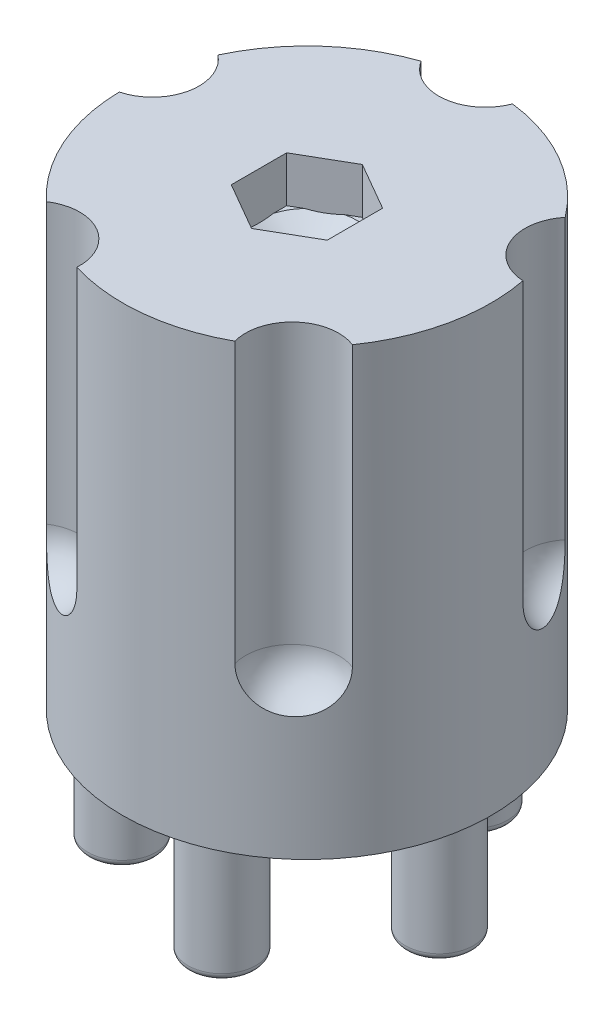
from build123d import *

# Parameters (mm, degrees)
SKETCH1_R           = 25.75
BOSS_EXTRUDE1_DEPTH = 62
SKETCH2_R           = 4.75
BOSS_EXTRUDE2_DEPTH = 18
FILLET1_R           = 1
FILLET2_R           = 1
CUT_EXTRUDE1_DEPTH  = 6.4
SKETCH4_R           = 10
CUT_EXTRUDE2_DEPTH  = 45
SKETCH5_R           = 4
CUT_EXTRUDE3_DEPTH  = 73.767609553
SKETCH6_R           = 6.5
CUT_EXTRUDE4_DEPTH  = 45
FILLET3_R           = 6
CHAMFER3_SIZE       = 3
CHAMFER3_SIZE_2     = 1.732050808
SKETCH7_R           = 6.6
CUT_EXTRUDE5_DEPTH  = 6


with BuildPart() as part:
    # Sketch1 → Boss-Extrude1 (new body)
    with BuildSketch(Plane(origin=(0, 0, 0), x_dir=(1, 0, 0), z_dir=(0, 1, 0))):
        with Locations(Location((0, 0, 0), (0, 0, 270))):
            Circle(SKETCH1_R)
    extrude(amount=BOSS_EXTRUDE1_DEPTH)

    # Sketch2 → Boss-Extrude2 (add)
    with BuildSketch(Plane.XZ):
        with Locations(Location((18.5, 0, 0), (0, 0, 90))):
            Circle(SKETCH2_R)
        with Locations(Location((5.716814396, -17.594545551, 0), (0, 0, 90))):
            Circle(SKETCH2_R)
        with Locations(Location((-14.966814396, -10.874027167, 0), (0, 0, 90))):
            Circle(SKETCH2_R)
        with Locations(Location((-14.966814396, 10.874027167, 0), (0, 0, 90))):
            Circle(SKETCH2_R)
        with Locations(Location((5.716814396, 17.594545551, 0), (0, 0, 90))):
            Circle(SKETCH2_R)
    extrude(amount=BOSS_EXTRUDE2_DEPTH)

    # Fillet1
    fillet1_edges = [part.edges().sort_by_distance(p)[0] for p in [
        (-14.966814396, 0, -15.624027167),
        (-14.966814396, 0, 6.124027167),
        (5.716814396, 0, 12.844545551),
        (18.5, 0, -4.75),
        (5.716814396, 0, -22.344545551),
    ]]
    fillet(fillet1_edges, radius=FILLET1_R)

    # Fillet2
    fillet2_edges = [part.edges().sort_by_distance(p)[0] for p in [
        (-14.966814396, -18, -15.624027167),
        (-14.966814396, -18, 6.124027167),
        (5.716814396, -18, 12.844545551),
        (18.5, -18, -4.75),
        (5.716814396, -18, -22.344545551),
    ]]
    fillet(fillet2_edges, radius=FILLET2_R)

    # Sketch3 → Cut-Extrude1 (cut)
    with BuildSketch(Plane(origin=(0, 62, 0), x_dir=(1, 0, 0), z_dir=(0, 1, 0))):
        Polygon((0, -7.736493607), (6.7, -3.868246804), (6.7, 3.868246804), (0, 7.736493607), (-6.7, 3.868246804), (-6.7, -3.868246804), align=None)
    extrude(amount=-CUT_EXTRUDE1_DEPTH, mode=Mode.SUBTRACT)

    # Sketch4 → Cut-Extrude2 (cut)
    with BuildSketch(Plane.XZ):
        with Locations(Location((0, 0, 0), (0, 0, 270))):
            Circle(SKETCH4_R)
    extrude(amount=-CUT_EXTRUDE2_DEPTH, mode=Mode.SUBTRACT)

    # Sketch5 → Cut-Extrude3 (cut, through all)
    with BuildSketch(Plane.XZ.offset(-45)):
        with Locations(Location((0, 0, 0), (0, 0, 270))):
            Circle(SKETCH5_R)
    extrude(amount=-CUT_EXTRUDE3_DEPTH, mode=Mode.SUBTRACT)

    # Sketch6 → Cut-Extrude4 (cut)
    with BuildSketch(Plane(origin=(0, 62, 0), x_dir=(1, 0, 0), z_dir=(0, 1, 0))):
        with Locations((-14, -24.248711306)):
            Circle(SKETCH6_R)
        with Locations((-27.388132821, 5.821527343)):
            Circle(SKETCH6_R)
        with Locations((-2.926796971, 27.84661307)):
            Circle(SKETCH6_R)
        with Locations((25.579272814, 11.388626006)):
            Circle(SKETCH6_R)
        with Locations((18.735656978, -20.808055113)):
            Circle(SKETCH6_R)
    extrude(amount=-CUT_EXTRUDE4_DEPTH, mode=Mode.SUBTRACT)

    # Fillet3
    # the kernel refuses this fillet: 6 mm, written as the material it adds along each edge
    with BuildSketch(Plane(origin=(-14, 17, 24.248711306), x_dir=(-0.5027182271719127, 0, 0.8644503363809452), z_dir=(0.8644503363809452, 0, 0.5027182271719127))) as fillet3_piece_1_section:
        with BuildLine():
            CenterArc((6.5 - FILLET3_R, -FILLET3_R), FILLET3_R, 0, 90)
            Line((6.5 - FILLET3_R, 0), (6.5, 0))
            Line((6.5, 0), (6.5, -FILLET3_R))
        make_face()
    fillet3_piece_1 = revolve(axis=Axis((-14, 17, 24.248711306), (0, -1, 0)), revolution_arc=359.64, mode=Mode.PRIVATE)
    fillet3_piece_1 = fillet3_piece_1 & Plane(origin=(0, 19.401898433, 0), x_dir=(0, 0, 1), z_dir=(0, -1, 0)) * Cylinder(25.75, 27, mode=Mode.PRIVATE)
    add(fillet3_piece_1)
    with BuildSketch(Plane(origin=(-27.388132821, 17, -5.821527343), x_dir=(-0.9774896010068019, 0, -0.21098360107734276), z_dir=(-0.21098360107734276, 0, 0.9774896010068019))) as fillet3_piece_2_section:
        with BuildLine():
            CenterArc((6.5 - FILLET3_R, -FILLET3_R), FILLET3_R, 0, 90)
            Line((6.5 - FILLET3_R, 0), (6.5, 0))
            Line((6.5, 0), (6.5, -FILLET3_R))
        make_face()
    fillet3_piece_2 = revolve(axis=Axis((-27.388132821, 17, -5.821527343), (0, -1, 0)), revolution_arc=359.64, mode=Mode.PRIVATE)
    fillet3_piece_2 = fillet3_piece_2 & Plane(origin=(0, 19.401898433, 0), x_dir=(0, 0, 1), z_dir=(0, -1, 0)) * Cylinder(25.75, 27, mode=Mode.PRIVATE)
    add(fillet3_piece_2)
    with BuildSketch(Plane(origin=(-2.926796971, 17, -27.84661307), x_dir=(-0.1076523249817097, 0, -0.9941886022913521), z_dir=(0.9941886022913521, 0, -0.1076523249817097))) as fillet3_piece_3_section:
        with BuildLine():
            CenterArc((6.5 - FILLET3_R, FILLET3_R), FILLET3_R, 270, 90)
            Line((6.5 - FILLET3_R, 0), (6.5, 0))
            Line((6.5, 0), (6.5, FILLET3_R))
        make_face()
    fillet3_piece_3 = revolve(axis=Axis((-2.926796971, 17, -27.84661307), (0, 1, 0)), revolution_arc=359.64, mode=Mode.PRIVATE)
    fillet3_piece_3 = fillet3_piece_3 & Plane(origin=(0, 19.401898433, 0), x_dir=(0, 0, 1), z_dir=(0, -1, 0)) * Cylinder(25.75, 26, mode=Mode.PRIVATE)
    add(fillet3_piece_3)
    with BuildSketch(Plane(origin=(25.579272814, 17, -11.388626006), x_dir=(0.9122631507322384, 0, -0.40960461889008193), z_dir=(0.40960461889008193, 0, 0.9122631507322384))) as fillet3_piece_4_section:
        with BuildLine():
            CenterArc((6.5 - FILLET3_R, FILLET3_R), FILLET3_R, 270, 90)
            Line((6.5 - FILLET3_R, 0), (6.5, 0))
            Line((6.5, 0), (6.5, FILLET3_R))
        make_face()
    fillet3_piece_4 = revolve(axis=Axis((25.579272814, 17, -11.388626006), (0, 1, 0)), revolution_arc=359.64, mode=Mode.PRIVATE)
    fillet3_piece_4 = fillet3_piece_4 & Plane(origin=(0, 19.401898433, 0), x_dir=(0, 0, 1), z_dir=(0, -1, 0)) * Cylinder(25.75, 27, mode=Mode.PRIVATE)
    add(fillet3_piece_4)
    with BuildSketch(Plane(origin=(18.735656978, 17, 20.808055113), x_dir=(0.6714619588183017, 0, 0.7410390258683339), z_dir=(-0.7410390258683339, 0, 0.6714619588183017))) as fillet3_piece_5_section:
        with BuildLine():
            CenterArc((6.5 - FILLET3_R, FILLET3_R), FILLET3_R, 270, 90)
            Line((6.5 - FILLET3_R, 0), (6.5, 0))
            Line((6.5, 0), (6.5, FILLET3_R))
        make_face()
    fillet3_piece_5 = revolve(axis=Axis((18.735656978, 17, 20.808055113), (0, 1, 0)), revolution_arc=359.64, mode=Mode.PRIVATE)
    fillet3_piece_5 = fillet3_piece_5 & Plane(origin=(0, 19.401898433, 0), x_dir=(0, 0, 1), z_dir=(0, -1, 0)) * Cylinder(25.75, 27, mode=Mode.PRIVATE)
    add(fillet3_piece_5)

    # Chamfer3
    # the kernel refuses this chamfer: 3, 1.732050808 mm, written as the material it takes off along each edge
    with BuildSketch(Plane(origin=(0, 55.6, 0), x_dir=(0, 0, -1), z_dir=(-1, 0, 0))) as chamfer3_piece_1_section:
        Polygon((4 + CHAMFER3_SIZE, 0), (4, CHAMFER3_SIZE_2), (4, 0), align=None)
    chamfer3_piece_1 = revolve(axis=Axis((0, 55.6, 0), (0, -1, 0)), mode=Mode.PRIVATE)
    chamfer3_piece_1 = split(chamfer3_piece_1, bisect_by=Plane(origin=(0.978192269, 54.773023112, 7.171734038), z_dir=(-0.4999999999999997, 0, -0.8660254037844388)), keep=Keep.TOP, mode=Mode.PRIVATE)
    chamfer3_piece_1 = split(chamfer3_piece_1, bisect_by=Plane(origin=(-0.978192269, 54.773023112, 7.171734038), z_dir=(0.5000000000000001, 0, -0.8660254037844386)), keep=Keep.TOP, mode=Mode.PRIVATE)
    chamfer3_piece_1 = split(chamfer3_piece_1, bisect_by=Plane(origin=(-6.7, 54.773023112, 5.477455329), z_dir=(1, 0, 0)), keep=Keep.TOP, mode=Mode.PRIVATE)
    chamfer3_piece_1 = split(chamfer3_piece_1, bisect_by=Plane(origin=(-5.721807731, 54.773023112, -4.433006373), z_dir=(0.49999999999999994, 0, 0.8660254037844387)), keep=Keep.TOP, mode=Mode.PRIVATE)
    chamfer3_piece_1 = split(chamfer3_piece_1, bisect_by=Plane(origin=(5.721807731, 54.773023112, -4.433006373), z_dir=(-0.5000000000000001, 0, 0.8660254037844386)), keep=Keep.TOP, mode=Mode.PRIVATE)
    chamfer3_piece_1 = split(chamfer3_piece_1, bisect_by=Plane(origin=(6.7, 54.773023112, 5.477455329), z_dir=(-1, 0, 0)), keep=Keep.TOP, mode=Mode.PRIVATE)
    add(chamfer3_piece_1, mode=Mode.SUBTRACT)

    # Sketch7 → Cut-Extrude5 (cut)
    with BuildSketch(Plane.XZ.offset(-45)):
        with Locations(Location((0, 0, 0), (0, 0, 270))):
            Circle(SKETCH7_R)
    extrude(amount=-CUT_EXTRUDE5_DEPTH, mode=Mode.SUBTRACT)


solid = part.part
